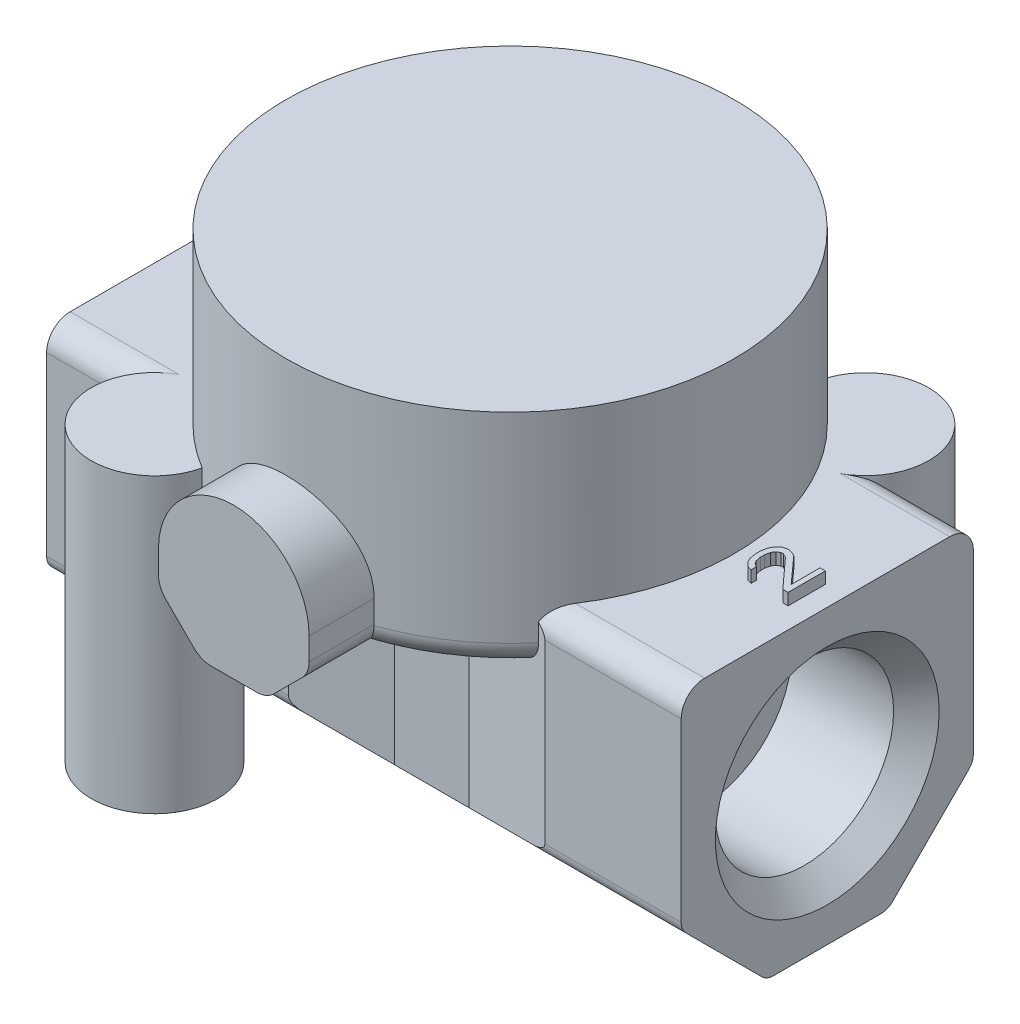
from build123d import *

# Parameters (mm, degrees)
BOSS_EXTRUDE1_DEPTH      = 39.612
CUT_EXTRUDE1_DEPTH       = 5.547195969
CUT_EXTRUDE1_DEPTH_BACK  = 5.547195969
CUT_EXTRUDE2_DEPTH       = 8.276160233
CUT_EXTRUDE2_DEPTH_BACK  = 8.276160233
SKETCH3_W                = 84.337272164
SKETCH3_H                = 65.415448281
SKETCH5_R                = 3.95
BOSS_EXTRUDE2_DEPTH      = 18.26969385
BOSS_EXTRUDE3_DEPTH      = 20
SKETCH7_R                = 3.937
BOSS_EXTRUDE4_DEPTH      = 18.26969385
BOSS_EXTRUDE5_DEPTH      = 0.7
BOSS_EXTRUDE5_DEPTH_BACK = 0.7
BOSS_EXTRUDE6_DEPTH      = 0.7
BOSS_EXTRUDE6_DEPTH_BACK = 0.7


with BuildPart() as part:
    # Sketch1 → Boss-Extrude1 (new body)
    with BuildSketch(Plane(origin=(19.8, 0, 0), x_dir=(0, 0, -1), z_dir=(1, 0, 0))):
        with BuildLine():
            Line((-8.826801422, -4.086394595), (-4.070394308, -8.842801555))
            ThreePointArc((-4.070394308, -8.842801555), (-3.745970956, -9.059574301), (-3.363287522, -9.135694762))
            Line((-3.363287522, -9.135694762), (3.363287818, -9.135694653))
            ThreePointArc((3.363287818, -9.135694653), (3.745971249, -9.059574179), (4.070394595, -8.842801423))
            Line((4.070394595, -8.842801423), (8.826801554, -4.086394309))
            ThreePointArc((8.826801554, -4.086394309), (9.043574313, -3.761970925), (9.119694762, -3.379287456))
            Line((9.119694762, -3.379287456), (9.119693846, 7.624000128))
            ThreePointArc((9.119693846, 7.624000128), (8.686301509, 8.6703016), (7.64, 9.10369385))
            Line((7.64, 9.10369385), (-7.650000004, 9.10369385))
            ThreePointArc((-7.650000004, 9.10369385), (-8.689230454, 8.673230525), (-9.119693854, 7.634000106))
            Line((-9.119693854, 7.634000106), (-9.119694652, -3.37928773))
            ThreePointArc((-9.119694652, -3.37928773), (-9.043574195, -3.761971209), (-8.826801422, -4.086394595))
        make_face()
    extrude(amount=-BOSS_EXTRUDE1_DEPTH)

    # Sketch2 → Cut-Extrude1 (cut, two sides: drawn at the far end of the back side and taken through both)
    with BuildSketch(Plane.XY.offset(-CUT_EXTRUDE1_DEPTH_BACK)):
        Polygon((-11.400000002, -16.447815487), (11.400000106, -16.447815487), (11.400000106, -9.166000001), (4.799999912, -7.366), (-4.8, -7.366), (-11.400000002, -9.166000001), align=None)
    extrude(amount=CUT_EXTRUDE1_DEPTH + CUT_EXTRUDE1_DEPTH_BACK, mode=Mode.SUBTRACT)

    # Sketch3 → Cut-Extrude2 (cut, two sides: drawn at the far end of the back side and taken through both)
    with BuildSketch(Plane(origin=(0, 0, 0), x_dir=(1, 0, 0), z_dir=(0, 1, 0)).offset(-CUT_EXTRUDE2_DEPTH_BACK)):
        with Locations((0.851814883, -0.975045123)):
            Rectangle(SKETCH3_W, SKETCH3_H)
        Polygon((-26.152859771, 16.921805373), (-26.152859771, -16.921805373), (0.145459355, -7.35), (4.799999991, -7.35), (30.199191541, -14.277051746), (30.199191541, 14.277052238), (4.8, 7.35), (0.145459355, 7.35), align=None, mode=Mode.SUBTRACT)
    extrude(amount=CUT_EXTRUDE2_DEPTH + CUT_EXTRUDE2_DEPTH_BACK, mode=Mode.SUBTRACT)

    # Sketch4 → Revolve1 (revolve)
    with BuildSketch(Plane(origin=(0, 0, 0), x_dir=(0, 0, -1), z_dir=(1, 0, 0))):
        with BuildLine():
            Line((0, 19.65), (14.000000003, 19.65))
            Line((14.000000003, 19.65), (14.000000003, 7.149999997))
            ThreePointArc((14.000000003, 7.149999997), (13.560660172, 6.089339827), (12.5, 5.649999999))
            Line((12.5, 5.649999999), (0, 5.649999999))
            Line((0, 5.649999999), (0, 19.65))
        make_face()
    revolve(axis=Axis((0, 5.649999999, 0), (0, 1, 0)))

    # Sketch5 → Boss-Extrude2 (add)
    with BuildSketch(Plane(origin=(0, -9.166, 0), x_dir=(-1, 0, 0), z_dir=(0, -1, 0))):
        with Locations((11.1, -11.1)):
            Circle(SKETCH5_R)
    extrude(amount=-BOSS_EXTRUDE2_DEPTH)

    # Sketch6 → Boss-Extrude3 (add)
    with BuildSketch(Plane.XY.offset(17.25)):
        with BuildLine():
            Line((-4.7, 8.63), (-4.7, 7.231261469))
            ThreePointArc((-4.7, 7.231261469), (-4.583992408, 6.648051918), (-4.253630735, 6.153630735))
            Line((-4.253630735, 6.153630735), (-2.496369265, 4.396369265))
            ThreePointArc((-2.496369265, 4.396369265), (-2.001948082, 4.066007592), (-1.418738531, 3.95))
            Line((-1.418738531, 3.95), (1.418738531, 3.95))
            ThreePointArc((1.418738531, 3.95), (2.001948082, 4.066007592), (2.496369265, 4.396369265))
            Line((2.496369265, 4.396369265), (4.253630735, 6.153630735))
            ThreePointArc((4.253630735, 6.153630735), (4.583992408, 6.648051918), (4.7, 7.231261469))
            Line((4.7, 7.231261469), (4.7, 8.63))
            ThreePointArc((4.7, 8.63), (0, 13.350042553), (-4.7, 8.63))
        make_face()
    extrude(amount=-BOSS_EXTRUDE3_DEPTH)


with BuildPart() as boss_extrude4_tool:
    # Sketch7 → Boss-Extrude4 (new body)
    with BuildSketch(Plane(origin=(0, -9.166, 0), x_dir=(-1, 0, 0), z_dir=(0, -1, 0))):
        with Locations((-11.1, 11.1)):
            Circle(SKETCH7_R)
    extrude(amount=-BOSS_EXTRUDE4_DEPTH)


with BuildPart() as part_1:
    add(part.part)


with BuildPart() as part_2:
    # Boss-Extrude4: joined with boss_extrude4_tool
    add(part_1.part.fuse(boss_extrude4_tool.part, tol=0.00001))

    # Sketch8 → Boss-Extrude5 (add, two sides: drawn at the far end of the back side and taken through both)
    with BuildSketch(Plane(origin=(0, 9.134, 0), x_dir=(1, 0, 0), z_dir=(0, 1, 0)).offset(-BOSS_EXTRUDE5_DEPTH_BACK)):
        Polygon((-15.2, -0.265), (-15.2, 0.1225), (-15.661702073, 0.51), (-16.189361769, 0.51), (-15.727659512, 0.1225), (-18.3, 0.1225), (-18.3, -0.265), align=None)
    extrude(amount=BOSS_EXTRUDE5_DEPTH + BOSS_EXTRUDE5_DEPTH_BACK)

    # Sketch9 → Boss-Extrude6 (add, two sides: drawn at the far end of the back side and taken through both)
    with BuildSketch(Plane(origin=(0, 9.134, 0), x_dir=(1, 0, 0), z_dir=(0, 1, 0)).offset(-BOSS_EXTRUDE6_DEPTH_BACK)):
        Polygon((18.5, -1.143), (18.5, 1.182), (18.170212759, 1.182), (18.170212759, -0.626333318), (16.719148964, 0.98825), (16.521276647, 1.117416728), (16.257446891, 1.182), (16.125531828, 1.182), (15.861702073, 1.117416728), (15.597872317, 0.859083272), (15.465957439, 0.60075), (15.4, 0.21325), (15.4, -0.045083364), (15.465957439, -0.497166682), (15.597872317, -0.7555), (15.861702073, -1.013833329), (16.125531828, -1.078416665), (16.125531828, -0.7555), (15.927659512, -0.626333318), (15.795744634, -0.432583318), (15.729787195, -0.109666636), (15.729787195, 0.148666636), (15.795744634, 0.471583272), (15.927659512, 0.665333272), (16.125531828, 0.7945), (16.257446891, 0.7945), (16.521276647, 0.665333272), (18.170212759, -1.143), align=None)
    extrude(amount=BOSS_EXTRUDE6_DEPTH + BOSS_EXTRUDE6_DEPTH_BACK)

    # Sketch10 → Cut-Revolve1 (revolve, cut)
    with BuildSketch(Plane(origin=(0, 0, -11.1), x_dir=(-1, 0, 0), z_dir=(0, 0, -1))):
        Polygon((-11.1125, -9.166), (-13.97, -9.166), (-13.208, -8.404), (-13.208, 0.484), (-11.1125, 1.743103427), align=None)
    revolve(axis=Axis((11.1125, 1.743206506, -11.1), (0, -1, 0)), mode=Mode.SUBTRACT)

    # Sketch11 → Cut-Revolve2 (revolve, cut)
    with BuildSketch(Plane(origin=(0, 0, 11.1), x_dir=(-1, 0, 0), z_dir=(0, 0, -1))):
        Polygon((11.1125, -9.166), (8.317, -9.166), (9.0455, -8.4375), (9.0455, 0.501124528), (11.1125, 1.743103428), align=None)
    revolve(axis=Axis((-11.1125, 1.743206506, 11.1), (0, -1, 0)), mode=Mode.SUBTRACT)

    # Sketch12 → Cut-Revolve3 (revolve, cut)
    with BuildSketch(Plane(origin=(0, 0, 0), x_dir=(-1, 0, 0), z_dir=(0, 0, -1))):
        Polygon((12, 0), (12, 5.4991), (18.3111, 5.4991), (19.812, 7), (19.812, 0), align=None)
    revolve(axis=Axis((-19.812, 0, 0), (1, 0, 0)), mode=Mode.SUBTRACT)

    # Sketch13 → Cut-Revolve4 (revolve, cut)
    with BuildSketch(Plane(origin=(0, 0, 0), x_dir=(-1, 0, 0), z_dir=(0, 0, -1))):
        Polygon((-19.8, 0), (-19.8, 6.985), (-18.3776, 5.5626), (-12, 5.5626), (-12, 0), align=None)
    revolve(axis=Axis((12, 0, 0), (1, 0, 0)), mode=Mode.SUBTRACT)


solid = part_2.part
